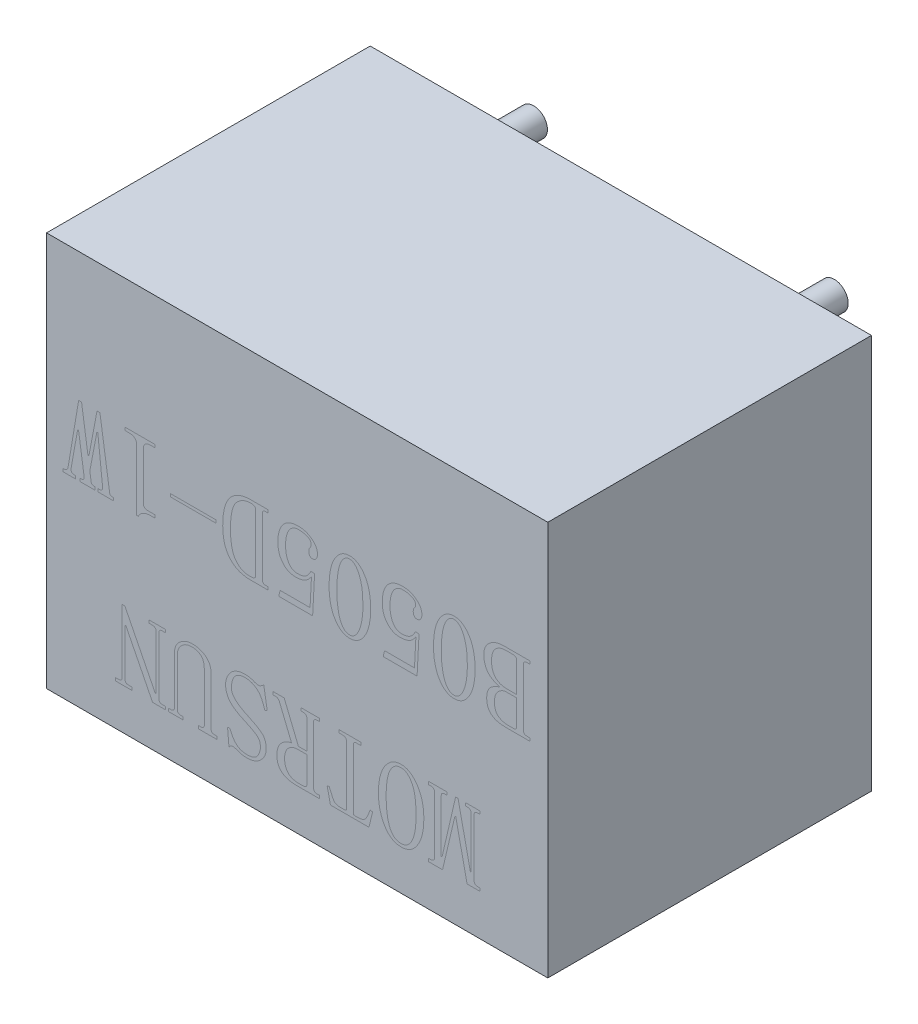
from build123d import *

# Parameters (mm, degrees)
SKETCH_1_W      = 12.7
SKETCH_1_H      = 10
EXTRUDE_1_DEPTH = 8.2
SKETCH_2_R      = 0.35
EXTRUDE_2_DEPTH = 1.6


with BuildPart() as part:
    # 草图1 → 凸台-拉伸1 (new body)
    with BuildSketch(Plane.XY):
        with Locations((6.35, 5)):
            Rectangle(SKETCH_1_W, SKETCH_1_H)
    extrude(amount=EXTRUDE_1_DEPTH)

    # 草图2 → 凸台-拉伸2 (add)
    with BuildSketch(Plane(origin=(0, 0, 0), x_dir=(-1, 0, 0), z_dir=(0, 0, -1))):
        with Locations((-10.16, 8.81)):
            Circle(SKETCH_2_R)
        with Locations((-2.54, 8.81)):
            Circle(SKETCH_2_R)
        with Locations((-2.54, 1.19)):
            Circle(SKETCH_2_R)
        with Locations((-7.62, 1.19)):
            Circle(SKETCH_2_R)
    extrude(amount=EXTRUDE_2_DEPTH)


solid = part.part
